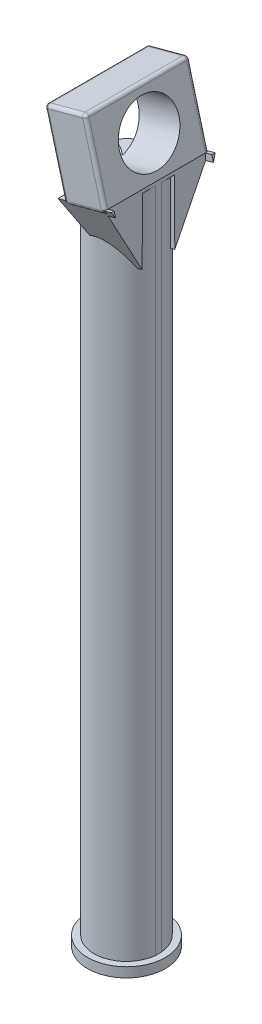
from build123d import *

# Parameters (mm, degrees)
SKETCH_1_R               = 15
SKETCH_1_R_2             = 10
SKETCH_1_R_3             = 1.070370935
EXTRUDE_2_DEPTH          = 3
EXTRUDE_7_DEPTH          = 220.766502815
EXTRUDE_7_DEPTH_BACK     = 3
SKETCH_3_R               = 10
SKETCH_6_W               = 32.150004278
SKETCH_6_H               = 24.543060803
EXTRUDE_8_DEPTH          = 13
SKETCH_7_R               = 9.2
CUT_EXTRUDE_1_DEPTH      = 44
CUT_EXTRUDE_2_DEPTH      = 218
FILLET_1_R               = 1
FILLET_2_R               = 1
FILLET_3_R               = 1
EXTRUDE_9_DEPTH          = 15
EXTRUDE_9_DEPTH_BACK     = 2
SKETCH_10_W              = 8.615383554
SKETCH_10_H              = 30.150004278
CUT_EXTRUDE_3_DEPTH      = 265
CUT_EXTRUDE_4_DEPTH      = 10
CUT_EXTRUDE_4_DEPTH_BACK = 111
SKETCH_12_W              = 40.878647102
SKETCH_12_H              = 15
SKETCH_13_R              = 12
EXTRUDE_10_DEPTH         = 3
SKETCH_14_R              = 1.49
CUT_EXTRUDE_5_DEPTH      = 25


with BuildPart() as part:
    # 草图1 → 凸台-拉伸2 (new body)
    with BuildSketch(Plane(origin=(0, 0, 0), x_dir=(1, 0, 0), z_dir=(0, 1, 0))):
        with Locations(Location((0, 0, 0), (0, 0, 270))):
            Circle(SKETCH_1_R)
        with Locations(Location((0, 0, 0), (0, 0, 270))):
            Circle(SKETCH_1_R_2, mode=Mode.SUBTRACT)
        with Locations(Location((12, 0, 0), (0, 0, 270))):
            Circle(SKETCH_1_R_3, mode=Mode.SUBTRACT)
        with Locations(Location((-12, 0, 0), (0, 0, 270))):
            Circle(SKETCH_1_R_3, mode=Mode.SUBTRACT)
        with Locations(Location((0, 12, 0), (0, 0, 270))):
            Circle(SKETCH_1_R_3, mode=Mode.SUBTRACT)
        with Locations(Location((0, -12, 0), (0, 0, 270))):
            Circle(SKETCH_1_R_3, mode=Mode.SUBTRACT)
    extrude(amount=EXTRUDE_2_DEPTH)

    # 草图3 → 凸台-拉伸7 (add, two sides: drawn at the far end of the back side and taken through both)
    with BuildSketch(Plane(origin=(0, 3, 0), x_dir=(1, 0, 0), z_dir=(0, 1, 0)).offset(-EXTRUDE_7_DEPTH_BACK)):
        with Locations(Location((0, 0, 0), (0, 0, 270))):
            Circle(SKETCH_3_R)
    extrude(amount=EXTRUDE_7_DEPTH + EXTRUDE_7_DEPTH_BACK)

    # 草图6 → 凸台-拉伸8 (add)
    with BuildSketch(Plane(origin=(65.479343136, 17.545137114, 0), x_dir=(0, 0, 1), z_dir=(-0.9659258262890673, -0.25881904510252474, 0))):
        with Locations((0.609852797, 225.767598204)):
            Rectangle(SKETCH_6_W, SKETCH_6_H)
    extrude(amount=EXTRUDE_8_DEPTH)

    # 草图7 → 切除-拉伸1 (cut)
    with BuildSketch(Plane(origin=(65.479343136, 17.545137114, 0), x_dir=(0, 0, -1), z_dir=(0.9659258262890673, 0.25881904510252474, 0))):
        with Locations(Location((0, 225.99664207, 0), (0, 0, 90))):
            Circle(SKETCH_7_R)
    extrude(amount=-CUT_EXTRUDE_1_DEPTH, mode=Mode.SUBTRACT)

    # 草图8 → 切除-拉伸2 (cut)
    with BuildSketch(Plane(origin=(0, 223.766502815, 0), x_dir=(1, 0, 0), z_dir=(0, 1, 0))):
        Polygon((-8.686752569, 5.062170738), (-8.608116415, -5.089236857), (-12.71958383, -5.121085641), (-12.798219984, 5.030321955), align=None)
    extrude(amount=-CUT_EXTRUDE_2_DEPTH, mode=Mode.SUBTRACT)

    # 圆角1
    fillet_1_edges = [part.edges().sort_by_distance(p)[0] for p in [
        (-2.408234698, 245.790955307, -15.465149342),
        (3.870283173, 247.473279101, 0.609852797),
        (-2.408234698, 245.790955307, 16.684854936),
        (-8.686752569, 244.108631514, 0.609852797),
    ]]
    fillet(fillet_1_edges, radius=FILLET_1_R)

    # 圆角2
    # the kernel refuses this fillet: 1 mm, written as the material it takes off along each edge
    with BuildSketch(Plane(origin=(3.163176392, 246.248534229, -14.465149342), x_dir=(0.9659258262890673, 0.25881904510252474, 0), z_dir=(0, 0, -1))) as fillet_2_piece_1_section:
        Polygon((0, 0), (FILLET_2_R * 1.02, 0), (FILLET_2_R * 1.02, -FILLET_2_R * 1.02), (0, -FILLET_2_R * 1.02), align=None)
    fillet_2_piece_1 = extrude(amount=FILLET_2_R * 1.02, mode=Mode.PRIVATE)
    fillet_2_piece_1 = fillet_2_piece_1 - Plane(origin=(3.163176392, 246.248534229, -14.465149342), x_dir=(-0.49999999999999645, -0.8660254037844407, 0), z_dir=(0, 0, -1)) * Sphere(FILLET_2_R, mode=Mode.PRIVATE)
    add(fillet_2_piece_1, mode=Mode.SUBTRACT)
    with BuildSketch(Plane(origin=(-7.462007697, 243.401524733, -14.465149342), x_dir=(0, 0, -1), z_dir=(-0.9659258262890673, -0.25881904510252474, 0))) as fillet_2_piece_2_section:
        Polygon((0, 0), (FILLET_2_R * 1.02, 0), (FILLET_2_R * 1.02, -FILLET_2_R * 1.02), (0, -FILLET_2_R * 1.02), align=None)
    fillet_2_piece_2 = extrude(amount=FILLET_2_R * 1.02, mode=Mode.PRIVATE)
    fillet_2_piece_2 = fillet_2_piece_2 - Plane(origin=(-7.462007697, 243.401524733, -14.465149342), x_dir=(0.1830127018922222, -0.6830127018922186, 0.7071067811865475), z_dir=(-0.9659258262890673, -0.25881904510252474, 0)) * Sphere(FILLET_2_R, mode=Mode.PRIVATE)
    add(fillet_2_piece_2, mode=Mode.SUBTRACT)
    with BuildSketch(Plane(origin=(-7.462007697, 243.401524733, 15.684854936), x_dir=(0, 0, 1), z_dir=(-0.9659258262890673, -0.25881904510252474, 0))) as fillet_2_piece_3_section:
        Polygon((0, 0), (FILLET_2_R * 1.02, 0), (FILLET_2_R * 1.02, FILLET_2_R * 1.02), (0, FILLET_2_R * 1.02), align=None)
    fillet_2_piece_3 = extrude(amount=FILLET_2_R * 1.02, mode=Mode.PRIVATE)
    fillet_2_piece_3 = fillet_2_piece_3 - Plane(origin=(-7.462007697, 243.401524733, 15.684854936), x_dir=(0.18301270189222205, -0.6830127018922186, -0.7071067811865475), z_dir=(-0.9659258262890673, -0.25881904510252474, 0)) * Sphere(FILLET_2_R, mode=Mode.PRIVATE)
    add(fillet_2_piece_3, mode=Mode.SUBTRACT)
    with BuildSketch(Plane(origin=(3.163176392, 246.248534229, 15.684854936), x_dir=(0.9659258262890673, 0.25881904510252474, 0), z_dir=(0, 0, 1))) as fillet_2_piece_4_section:
        Polygon((0, 0), (FILLET_2_R * 1.02, 0), (FILLET_2_R * 1.02, FILLET_2_R * 1.02), (0, FILLET_2_R * 1.02), align=None)
    fillet_2_piece_4 = extrude(amount=FILLET_2_R * 1.02, mode=Mode.PRIVATE)
    fillet_2_piece_4 = fillet_2_piece_4 - Plane(origin=(3.163176392, 246.248534229, 15.684854936), x_dir=(-0.49999999999999645, -0.8660254037844407, 0), z_dir=(0, 0, 1)) * Sphere(FILLET_2_R, mode=Mode.PRIVATE)
    add(fillet_2_piece_4, mode=Mode.SUBTRACT)
    with BuildSketch(Plane(origin=(-1.627434227, 221.6266001, 15.684854936), x_dir=(0, 0, 1), z_dir=(-0.9659258262890673, -0.25881904510252474, 0))) as fillet_2_piece_5_section:
        Polygon((0, 0), (FILLET_2_R * 1.02, 0), (FILLET_2_R * 1.02, -FILLET_2_R * 1.02), (0, -FILLET_2_R * 1.02), align=None)
    fillet_2_piece_5 = extrude(amount=FILLET_2_R * 1.02, mode=Mode.PRIVATE)
    fillet_2_piece_5 = fillet_2_piece_5 - Plane(origin=(-1.627434227, 221.6266001, 15.684854936), x_dir=(-0.1830127018922222, 0.6830127018922186, -0.7071067811865475), z_dir=(-0.9659258262890673, -0.25881904510252474, 0)) * Sphere(FILLET_2_R, mode=Mode.PRIVATE)
    add(fillet_2_piece_5, mode=Mode.SUBTRACT)
    with BuildSketch(Plane(origin=(12.6373093, 224.413550428, -15.465149342), x_dir=(0, 0, 1), z_dir=(-0.9659258262890673, -0.25881904510252474, 0))) as fillet_2_piece_6:
        with BuildLine():
            CenterArc((FILLET_2_R, FILLET_2_R), FILLET_2_R, 180, 90)
            Line((0, FILLET_2_R), (0, 0))
            Line((0, 0), (FILLET_2_R, 0))
        make_face()
    extrude(amount=18, mode=Mode.SUBTRACT)
    with BuildSketch(Plane(origin=(4.129102218, 246.507353274, -15.465149342), x_dir=(-0.9659258262890672, -0.2588190451025247, 0), z_dir=(0.25881904510252474, -0.9659258262890673, 0)), Plane(origin=(-8.427933524, 243.142705688, -15.465149342), x_dir=(0, 0, 1), z_dir=(0.25881904510252474, -0.9659258262890673, 0)), Plane(origin=(10.869542347, 221.35168825, 16.684854936), x_dir=(-0.9659258262890672, -0.2588190451025247, 0), z_dir=(-0.25881904510252474, 0.9659258262890673, 0))) as fillet_2_piece_7:
        with BuildLine():
            CenterArc((FILLET_2_R, -FILLET_2_R), FILLET_2_R, 90, 90)
            Line((0, -FILLET_2_R), (0, 0))
            Line((0, 0), (FILLET_2_R, 0))
        make_face()
    extrude(amount=26.043060803, mode=Mode.SUBTRACT)
    with BuildSketch(Plane(origin=(12.6373093, 224.413550428, 16.684854936), x_dir=(-0.2588190451025247, 0.9659258262890672, 0), z_dir=(-0.9659258262890673, -0.25881904510252474, 0))) as fillet_2_piece_8:
        with BuildLine():
            CenterArc((FILLET_2_R, FILLET_2_R), FILLET_2_R, 180, 90)
            Line((0, FILLET_2_R), (0, 0))
            Line((0, 0), (FILLET_2_R, 0))
        make_face()
    extrude(amount=14.5, mode=Mode.SUBTRACT)
    with BuildSketch(Plane(origin=(-2.593360053, 221.367781055, 16.684854936), x_dir=(0, 0, -1), z_dir=(-0.25881904510252474, 0.9659258262890673, 0))) as fillet_2_piece_9:
        with BuildLine():
            CenterArc((FILLET_2_R, -FILLET_2_R), FILLET_2_R, 90, 90)
            Line((0, -FILLET_2_R), (0, 0))
            Line((0, 0), (FILLET_2_R, 0))
        make_face()
    extrude(amount=22.543060803, mode=Mode.SUBTRACT)
    with BuildSketch(Plane(origin=(-2.334541008, 220.401855229, 7.223678228), x_dir=(-0.2588190451025276, 0.9659258262890665, 0), z_dir=(0, 0, 1))) as fillet_2_piece_10_section:
        with BuildLine():
            CenterArc((FILLET_2_R, -FILLET_2_R), FILLET_2_R, 90, 90)
            Line((0, -FILLET_2_R), (0, 0))
            Line((0, 0), (FILLET_2_R, 0))
        make_face()
    fillet_2_piece_10 = extrude(amount=8.461176708, mode=Mode.PRIVATE)
    fillet_2_piece_10 = fillet_2_piece_10 - Plane(origin=(0, 220.67611038, 0), x_dir=(0, 0, 1), z_dir=(0, -1, 0)) * Cylinder(10, 21, mode=Mode.PRIVATE)
    add(fillet_2_piece_10, mode=Mode.SUBTRACT)

    # 圆角3
    # the kernel refuses this fillet: 1 mm, written as the material it takes off along each edge
    with BuildSketch(Plane(origin=(-1.627434227, 221.6266001, -14.465149342), x_dir=(0.25881904510252474, -0.9659258262890673, 0), z_dir=(-0.9659258262890673, -0.25881904510252474, 0))) as fillet_3_piece_1_section:
        Polygon((0, 0), (FILLET_3_R, 0), (FILLET_3_R, -FILLET_3_R), (0, -FILLET_3_R), align=None)
    fillet_3_piece_1 = extrude(amount=FILLET_3_R, mode=Mode.PRIVATE)
    fillet_3_piece_1 = fillet_3_piece_1 - Plane(origin=(-1.627434227, 221.6266001, -14.465149342), x_dir=(-0.18301270189222205, 0.6830127018922186, 0.7071067811865475), z_dir=(-0.9659258262890673, -0.25881904510252474, 0)) * Sphere(FILLET_3_R, mode=Mode.PRIVATE)
    add(fillet_3_piece_1, mode=Mode.SUBTRACT)
    with BuildSketch(Plane(origin=(-2.334541008, 220.401855229, -14.465149342), x_dir=(-0.2588190451025293, 0.9659258262890661, 0), z_dir=(0, 0, 1))) as fillet_3_piece_2_section:
        with BuildLine():
            CenterArc((FILLET_3_R, -FILLET_3_R), FILLET_3_R, 90, 90)
            Line((0, -FILLET_3_R), (0, 0))
            Line((0, 0), (FILLET_3_R, 0))
        make_face()
    fillet_3_piece_2 = extrude(amount=7.241471114, mode=Mode.PRIVATE)
    fillet_3_piece_2 = fillet_3_piece_2 - Plane(origin=(0, 220.680283856, 0), x_dir=(0, 0, 1), z_dir=(0, -1, 0)) * Cylinder(10, 19, mode=Mode.PRIVATE)
    add(fillet_3_piece_2, mode=Mode.SUBTRACT)

    # 草图9 → 凸台-拉伸9 (add, two sides: drawn at the far end of the back side and taken through both)
    with BuildSketch(Plane(origin=(65.479343136, 17.545137114, 0), x_dir=(0, 0, 1), z_dir=(-0.9659258262890673, -0.25881904510252474, 0)).offset(-EXTRUDE_9_DEPTH_BACK)):
        Polygon((-15.465149342, 214.521357737), (-4.839983079, 214.521357737), (-4.955271508, 194.209196023), align=None)
        Polygon((16.619377138, 214.521357737), (5.079909852, 214.521357737), (5.089236857, 193.804302434), align=None)
    extrude(amount=EXTRUDE_9_DEPTH + EXTRUDE_9_DEPTH_BACK)

    # 草图10 → 切除-拉伸3 (cut)
    with BuildSketch(Plane(origin=(0, 3, 0), x_dir=(1, 0, 0), z_dir=(0, 1, 0))):
        with Locations((14.264821949, -0.609852797)):
            Rectangle(SKETCH_10_W, SKETCH_10_H)
    extrude(amount=CUT_EXTRUDE_3_DEPTH, mode=Mode.SUBTRACT)

    # 草图12 → 切除-拉伸4 (cut, two sides: drawn at the far end of the back side and taken through both)
    with BuildSketch(Plane(origin=(-8.647020453, 0, 0.066982674), x_dir=(0.007746097662068172, 0, 0.999969998535461), z_dir=(-0.999969998535461, 0, 0.007746097662068172)).offset(-CUT_EXTRUDE_4_DEPTH_BACK)):
        with Locations((1.109642623, 7.5)):
            Rectangle(SKETCH_12_W, SKETCH_12_H)
    extrude(amount=CUT_EXTRUDE_4_DEPTH + CUT_EXTRUDE_4_DEPTH_BACK, mode=Mode.SUBTRACT)

    # 草图13 → 凸台-拉伸10 (add)
    with BuildSketch(Plane.XZ.offset(-15)):
        with Locations(Location((0, 0, 0), (0, 0, 270))):
            Circle(SKETCH_13_R)
    extrude(amount=-EXTRUDE_10_DEPTH)

    # 草图14 → 切除-拉伸5 (cut)
    with BuildSketch(Plane(origin=(0, 15, 0), x_dir=(-1, 0, 0), z_dir=(0, -1, 0))):
        with Locations(Location((0, 0, 0), (0, 0, 90))):
            Circle(SKETCH_14_R)
    extrude(amount=-CUT_EXTRUDE_5_DEPTH, mode=Mode.SUBTRACT)


solid = part.part
